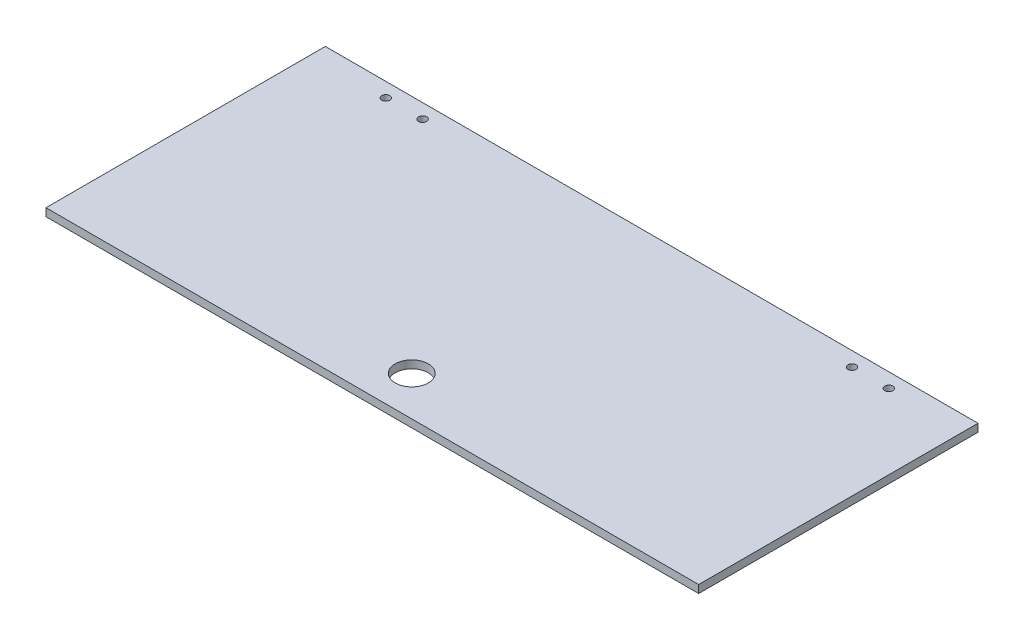
from build123d import *

# Parameters (mm, degrees)
SKETCH1_W           = 250
SKETCH1_H           = 107
SKETCH1_R           = 1.55
SKETCH1_R_2         = 6.35
BOSS_EXTRUDE1_DEPTH = 3


with BuildPart() as part:
    # Sketch1 → Boss-Extrude1 (new body)
    with BuildSketch(Plane(origin=(0, 0, 0), x_dir=(1, 0, 0), z_dir=(0, 1, 0))):
        with Locations((125, 53.5)):
            Rectangle(SKETCH1_W, SKETCH1_H)
        with Locations((28.65, 101.5)):
            Circle(SKETCH1_R, mode=Mode.SUBTRACT)
        with Locations((42.75, 101.5)):
            Circle(SKETCH1_R, mode=Mode.SUBTRACT)
        with Locations((207.25, 101.5)):
            Circle(SKETCH1_R, mode=Mode.SUBTRACT)
        with Locations((221.35, 101.5)):
            Circle(SKETCH1_R, mode=Mode.SUBTRACT)
        with Locations((125, 15.1)):
            Circle(SKETCH1_R_2, mode=Mode.SUBTRACT)
    extrude(amount=BOSS_EXTRUDE1_DEPTH)


solid = part.part
